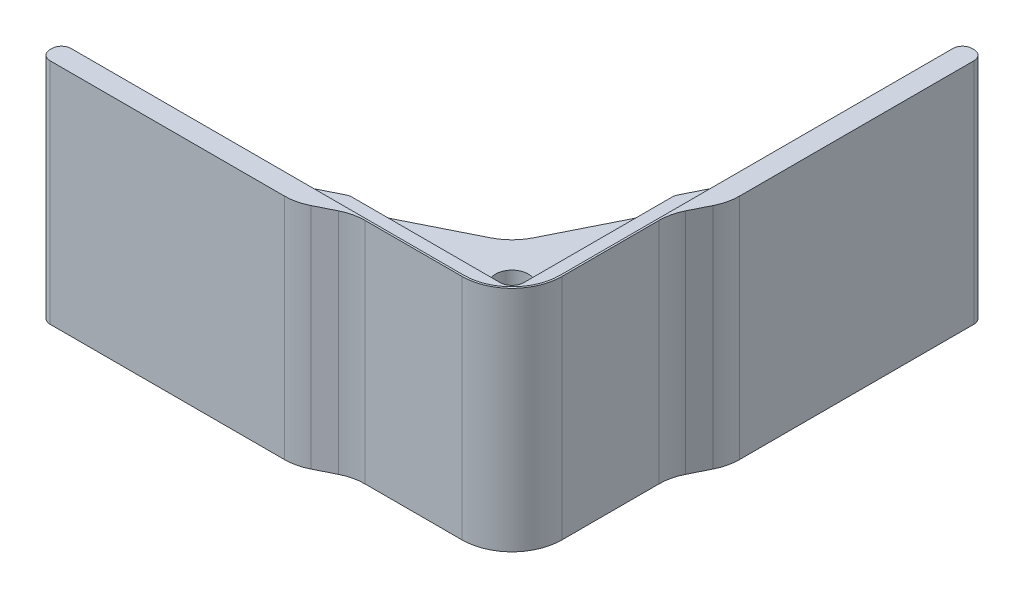
from build123d import *
from build123d.topology import SkipClean

# Parameters (mm, degrees)
SKETCH1_R           = 4.28625
BOSS_EXTRUDE1_DEPTH = 50.8
FILLET2_R           = 2.54
SKETCH7_W           = 42.968170869
SKETCH7_H           = 42.968170869
CUT_EXTRUDE3_DEPTH  = 3.429
FILLET9_R           = 3.175
BOSS_EXTRUDE2_DEPTH = 30.1625
CUT_EXTRUDE4_DEPTH  = 163.081683034
FILLET10_R          = 12.7


with BuildPart() as part:
    # Sketch1 → Boss-Extrude1 (new body)
    with BuildSketch(Plane(origin=(0, 0, 0), x_dir=(1, 0, 0), z_dir=(0, 1, 0))):
        with BuildLine():
            Line((-106.3752, -18.288), (0, -18.288))
            ThreePointArc((0, -18.288), (12.931568814, -12.931568814), (18.288, 0))
            Line((18.288, 0), (18.288, 106.3752))
            Line((18.288, 106.3752), (12.7, 106.3752))
            Line((12.7, 106.3752), (12.7, 53.934971632))
            Line((12.7, 53.934971632), (-9.469611004, 9.469611004))
            Line((-9.469611004, 9.469611004), (-53.934971632, -12.7))
            Line((-53.934971632, -12.7), (-106.3752, -12.7))
            Line((-106.3752, -12.7), (-106.3752, -18.288))
        make_face()
        Circle(SKETCH1_R, mode=Mode.SUBTRACT)
    extrude(amount=BOSS_EXTRUDE1_DEPTH)

    # Fillet2
    fillet2_edges = [part.edges().sort_by_distance(p)[0] for p in [
        (12.7, 25.4, -106.3752),
        (18.288, 25.4, -106.3752),
        (-106.3752, 25.4, 12.7),
        (-106.3752, 25.4, 18.288),
    ]]
    fillet(fillet2_edges, radius=FILLET2_R)

    # Sketch7 → Cut-Extrude3 (cut)
    with BuildSketch(Plane(origin=(0, 50.8, 0), x_dir=(1, 0, 0), z_dir=(0, 1, 0))):
        with Locations((-16.658085435, 16.658085435)):
            Rectangle(SKETCH7_W, SKETCH7_H)
    extrude(amount=-CUT_EXTRUDE3_DEPTH, mode=Mode.SUBTRACT)

    # Fillet9
    fillet9_edges = [part.edges().sort_by_distance(p)[0] for p in [
        (4.826, 49.0855, -38.142170869),
        (4.826, 49.0855, 4.826),
        (-38.142170869, 49.0855, 4.826),
    ]]
    fillet(fillet9_edges, radius=FILLET9_R)

    # Sketch8 → Boss-Extrude2 (add, symmetric)
    with SkipClean():  # the faces are left unmerged after this step: merging them gives an invalid solid
        with BuildSketch(Plane(origin=(0, 25.4, 0), x_dir=(1, 0, 0), z_dir=(0, 1, 0))):
            with BuildLine():
                Line((0, -12.7), (-103.8352, -12.7))
                ThreePointArc((-103.8352, -12.7), (-105.631251224, -13.443948776), (-106.3752, -15.24))
                Line((-106.3752, -15.24), (-106.3752, -15.748))
                ThreePointArc((-106.3752, -15.748), (-105.631251224, -17.544051224), (-103.8352, -18.288))
                Line((-103.8352, -18.288), (0, -18.288))
                ThreePointArc((0, -18.288), (12.931568814, -12.931568814), (18.288, 0))
                Line((18.288, 0), (18.288, 103.8352))
                ThreePointArc((18.288, 103.8352), (17.544051224, 105.631251224), (15.748, 106.3752))
                Line((15.748, 106.3752), (15.24, 106.3752))
                ThreePointArc((15.24, 106.3752), (13.443948776, 105.631251224), (12.7, 103.8352))
                Line((12.7, 103.8352), (12.7, 0))
                ThreePointArc((12.7, 0), (8.980256121, -8.980256121), (0, -12.7))
            make_face()
        extrude(amount=BOSS_EXTRUDE2_DEPTH, both=True)
    add(part.part.scale(1), mode=Mode.REPLACE)  # the faces are merged on a copy

    # Sketch9 → Cut-Extrude4 (cut, through all)
    with BuildSketch(Plane(origin=(0, 55.5625, 0), x_dir=(1, 0, 0), z_dir=(0, 1, 0))):
        with BuildLine():
            Line((-28.673096282, -13.208), (-38.862, -18.288))
            Line((-38.862, -18.288), (0, -18.288))
            ThreePointArc((0, -18.288), (12.931568814, -12.931568814), (18.288, 0))
            Line((18.288, 0), (18.288, 38.862))
            Line((18.288, 38.862), (13.208, 28.673096282))
            Line((13.208, 28.673096282), (13.208, 0))
            ThreePointArc((13.208, 0), (9.339466366, -9.339466366), (0, -13.208))
            Line((0, -13.208), (-28.673096282, -13.208))
        make_face()
    extrude(amount=-CUT_EXTRUDE4_DEPTH, mode=Mode.SUBTRACT)

    # Fillet10
    fillet10_edges = [part.edges().sort_by_distance(p)[0] for p in [
        (-38.862, 25.4, 18.288),
        (13.208, 25.4, -28.673096282),
        (18.288, 25.4, -38.862),
        (-28.673096282, 25.4, 13.208),
        (12.7, 25.4, -53.934971632),
        (-53.934971632, 25.4, 12.7),
        (-9.469611004, 23.6855, -9.469611004),
    ]]
    fillet(fillet10_edges, radius=FILLET10_R)


solid = part.part
